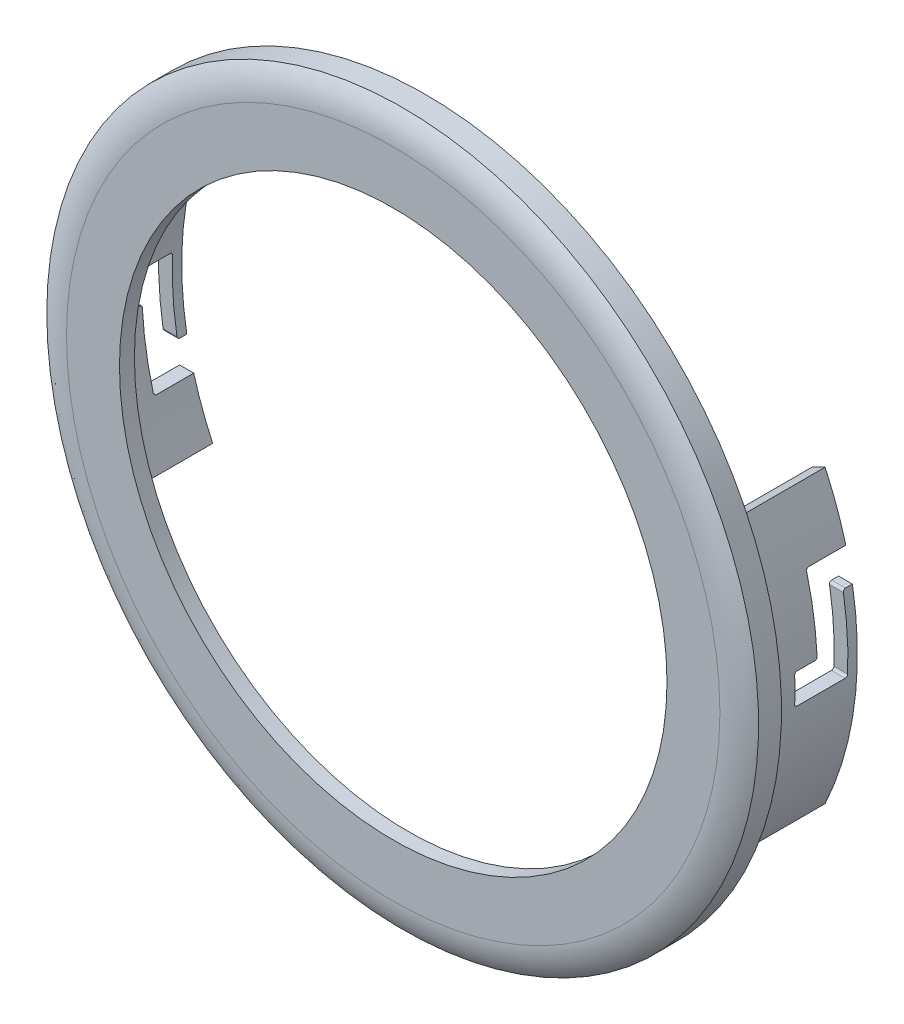
from build123d import *
from build123d.topology import SkipClean

# Parameters (mm, degrees)
CROQUIS1_R              = 75
SALIENTE_EXTRUIR1_DEPTH = 6.5
CROQUIS2_R              = 69.25
CROQUIS2_R_2            = 66.5
SALIENTE_EXTRUIR2_DEPTH = 17.5
REDONDEO1_R             = 10
CROQUIS5_R              = 60
CORTAR_EXTRUIR2_DEPTH   = 121.5
CORTAR_EXTRUIR3_START   = 121.5
CROQUIS6_R              = 66.5
CORTAR_EXTRUIR3_DEPTH   = 121.5
CORTAR_EXTRUIR4_START   = -2
CROQUIS7_R              = 63
CROQUIS7_R_2            = 60
CORTAR_EXTRUIR4_DEPTH   = 1.5
CORTAR_EXTRUIR5_DEPTH   = 3.5
CROQUIS9_R              = 65.632503002
CROQUIS9_R_2            = 55
SALIENTE_EXTRUIR3_DEPTH = 3
CORTAR_EXTRUIR7_DEPTH   = 90
MATRIZC1_COUNT          = 2
CROQUIS11_OUTSIDE_W     = 194.698
CROQUIS11_OUTSIDE_H     = 194.698
CROQUIS11_OUTSIDE_R     = 71.5
CORTAR_EXTRUIR8_DEPTH   = 61
ESCALA1_SCALE           = 0.8


with BuildPart() as part:
    # Croquis1 → Saliente-Extruir1 (new body)
    with BuildSketch(Plane.XY):
        Circle(CROQUIS1_R)
    extrude(amount=-SALIENTE_EXTRUIR1_DEPTH)

    # Croquis2 → Saliente-Extruir2 (add)
    with BuildSketch(Plane(origin=(0, 0, -6.5), x_dir=(-1, 0, 0), z_dir=(0, 0, -1))):
        with Locations(Location((0, 0, 0), (0, 0, 180))):
            Circle(CROQUIS2_R)
        Circle(CROQUIS2_R_2, mode=Mode.SUBTRACT)
    extrude(amount=SALIENTE_EXTRUIR2_DEPTH)

    # Redondeo1
    # the kernel refuses this fillet: 10 mm, written as the material it takes off along each edge
    with BuildSketch(Plane(origin=(0, 0, 0), x_dir=(1, 0, 0), z_dir=(0, -1, 0))) as redondeo1_piece_1:
        with BuildLine():
            CenterArc((65.632503002, -10), REDONDEO1_R, 20.487315115, 69.512684885)
            Line((65.632503002, 0), (65.632503002, 0.2))
            Line((65.632503002, 0.2), (75, 0.2))
            Line((75, 0.2), (75.2, 0))
            ThreePointArc((75.2, 0), (75.2, -3.25), (75.18734994, -6.43))
            Line((75.18734994, -6.43), (75, -6.5))
        make_face()
    revolve(axis=Axis((0, 0, 0), (0, 0, 1)), mode=Mode.SUBTRACT)

    # Croquis5 → Cortar-Extruir2 (cut)
    with BuildSketch(Plane(origin=(0, 0, -6.5), x_dir=(-1, 0, 0), z_dir=(0, 0, -1))):
        Circle(CROQUIS5_R)
    extrude(amount=-CORTAR_EXTRUIR2_DEPTH, mode=Mode.SUBTRACT)

    # Croquis6 → Cortar-Extruir3 (cut)
    with BuildSketch(Plane(origin=(0, 0, -6.5), x_dir=(-1, 0, 0), z_dir=(0, 0, -1)).offset(CORTAR_EXTRUIR3_START)):
        with BuildLine():
            ThreePointArc((53.795389167, 0), (-11.643453263, -52.520223645), (-48.755180109, 22.734913859))
            Line((-48.755180109, 22.734913859), (-54.378467222, 25.357095704))
            ThreePointArc((-54.378467222, 25.357095704), (-12.986376836, -58.577760427), (60, 0))
            ThreePointArc((60, 0), (58.577760427, 12.986376836), (54.378467222, 25.357095704))
            Line((54.378467222, 25.357095704), (48.755180109, 22.734913859))
            ThreePointArc((48.755180109, 22.734913859), (52.520223645, 11.643453263), (53.795389167, 0))
        make_face()
        with BuildLine():
            Line((-54.378467222, 25.357095704), (-48.755180109, 22.734913859))
            ThreePointArc((-48.755180109, 22.734913859), (0, 53.795389167), (48.755180109, 22.734913859))
            Line((48.755180109, 22.734913859), (54.378467222, 25.357095704))
            ThreePointArc((54.378467222, 25.357095704), (0, 60), (-54.378467222, 25.357095704))
        make_face()
        Circle(CROQUIS6_R)
        with BuildLine():
            Line((0, 0), (76.100368106, 35.486184436))
            ThreePointArc((76.100368106, 35.486184436), (0, 83.967465793), (-76.100368106, 35.486184436))
            Line((-76.100368106, 35.486184436), (0, 0))
        make_face()
        with BuildLine():
            ThreePointArc((60, 0), (-12.986376836, -58.577760427), (-54.378467222, 25.357095704))
            Line((-54.378467222, 25.357095704), (-60.269467838, 28.104114406))
            ThreePointArc((-60.269467838, 28.104114406), (-14.393234327, -64.923684473), (66.5, 0))
            ThreePointArc((66.5, 0), (64.923684473, 14.393234327), (60.269467838, 28.104114406))
            Line((60.269467838, 28.104114406), (54.378467222, 25.357095704))
            ThreePointArc((54.378467222, 25.357095704), (58.577760427, 12.986376836), (60, 0))
        make_face()
        with BuildLine():
            Line((-60.269467838, 28.104114406), (-54.378467222, 25.357095704))
            ThreePointArc((-54.378467222, 25.357095704), (0, 60), (54.378467222, 25.357095704))
            Line((54.378467222, 25.357095704), (60.269467838, 28.104114406))
            ThreePointArc((60.269467838, 28.104114406), (0, 66.5), (-60.269467838, 28.104114406))
        make_face()
    cortar_extruir3 = extrude(amount=-CORTAR_EXTRUIR3_DEPTH, mode=Mode.SUBTRACT)

    # Croquis7 → Cortar-Extruir4 (cut)
    with BuildSketch(Plane(origin=(0, 0, -6.5), x_dir=(-1, 0, 0), z_dir=(0, 0, -1)).offset(CORTAR_EXTRUIR4_START)):
        Circle(CROQUIS7_R)
        Circle(CROQUIS7_R_2, mode=Mode.SUBTRACT)
    extrude(amount=-CORTAR_EXTRUIR4_DEPTH, mode=Mode.SUBTRACT)

    # Croquis8 → Cortar-Extruir5 (cut)
    with SkipClean():  # the faces are left unmerged after this step: merging them gives an invalid solid
        with BuildSketch(Plane(origin=(0, 0, -6.5), x_dir=(-1, 0, 0), z_dir=(0, 0, -1))):
            with BuildLine():
                Line((59.77659711, 19.893678341), (-54.920166384, -30.867058887))
                ThreePointArc((-54.920166384, -30.867058887), (-57.610247866, -25.49626131), (-59.77659711, -19.893678341))
                Line((-59.77659711, -19.893678341), (54.920166384, 30.867058887))
                ThreePointArc((54.920166384, 30.867058887), (57.610247866, 25.49626131), (59.77659711, 19.893678341))
            make_face()
        extrude(amount=-CORTAR_EXTRUIR5_DEPTH, mode=Mode.SUBTRACT)

    # Croquis9 → Saliente-Extruir3 (add)
    with SkipClean():  # the faces are left unmerged after this step: merging them gives an invalid solid
        with BuildSketch(Plane.XY):
            Circle(CROQUIS9_R)
            Circle(CROQUIS9_R_2, mode=Mode.SUBTRACT)
        extrude(amount=-SALIENTE_EXTRUIR3_DEPTH)

    # Simetría1: Cortar-Extruir3 across plane
    with SkipClean():  # the faces are left unmerged after this step: merging them gives an invalid solid
        add(cortar_extruir3.mirror(Plane.ZX), mode=Mode.SUBTRACT)

    # Croquis10 → Cortar-Extruir7 (cut)
    with SkipClean():  # the faces are left unmerged after this step: merging them gives an invalid solid
        with BuildSketch(Plane(origin=(0, 0, 0), x_dir=(0, 0, -1), z_dir=(1, 0, 0))):
            with BuildLine():
                Line((20.1, -17.78519151), (24, -17.78519151))
                Line((24, -17.78519151), (24, -11.68519151))
                Line((24, -11.68519151), (22.6, -11.68519151))
                ThreePointArc((22.6, -11.68519151), (22.246446609, -11.538744901), (22.1, -11.18519151))
                Line((22.1, -11.18519151), (22.1, -3.05))
                Line((22.1, -3.05), (22.1, 2.55))
                ThreePointArc((22.1, 2.55), (21.953553391, 2.903553391), (21.6, 3.05))
                Line((21.6, 3.05), (11.95, 3.05))
                ThreePointArc((11.95, 3.05), (11.596446609, 2.903553391), (11.45, 2.55))
                Line((11.45, 2.55), (11.45, -2.55))
                ThreePointArc((11.45, -2.55), (11.596446609, -2.903553391), (11.95, -3.05))
                Line((11.95, -3.05), (15.5, -3.05))
                ThreePointArc((15.5, -3.05), (15.853553391, -3.196446609), (16, -3.55))
                Line((16, -3.55), (16, -11.68519151))
                Line((16, -11.68519151), (16, -17.28519151))
                ThreePointArc((16, -17.28519151), (16.146446609, -17.638744901), (16.5, -17.78519151))
                Line((16.5, -17.78519151), (20.1, -17.78519151))
            make_face()
        cortar_extruir7 = extrude(amount=-CORTAR_EXTRUIR7_DEPTH, mode=Mode.SUBTRACT)

    # MatrizC1: Cortar-Extruir7 ×2 about axis
    with SkipClean():  # the faces are left unmerged after this step: merging them gives an invalid solid
        matrizc1_axis = Axis((0, 0, 0), (0, 0, 1))
        for i in range(1, MATRIZC1_COUNT):
            add(cortar_extruir7.rotate(matrizc1_axis, i * 360 / MATRIZC1_COUNT), mode=Mode.SUBTRACT)

    # Croquis11 outside → Cortar-Extruir8 (cut)
    with SkipClean():  # the faces are left unmerged after this step: merging them gives an invalid solid
        with BuildSketch(Plane(origin=(0, 0, -6.5), x_dir=(-1, 0, 0), z_dir=(0, 0, -1))):
            Rectangle(CROQUIS11_OUTSIDE_W, CROQUIS11_OUTSIDE_H)
            Circle(CROQUIS11_OUTSIDE_R, mode=Mode.SUBTRACT)
        extrude(amount=-CORTAR_EXTRUIR8_DEPTH, mode=Mode.SUBTRACT)


with BuildPart() as part_1:
    # Escala1: scaled about (1.06e-07, 2.2e-08, -4.523321709)
    add(part.part.scale(ESCALA1_SCALE).moved(Location((2.1e-08, 4e-09, -0.904664342))))


solid = part_1.part
